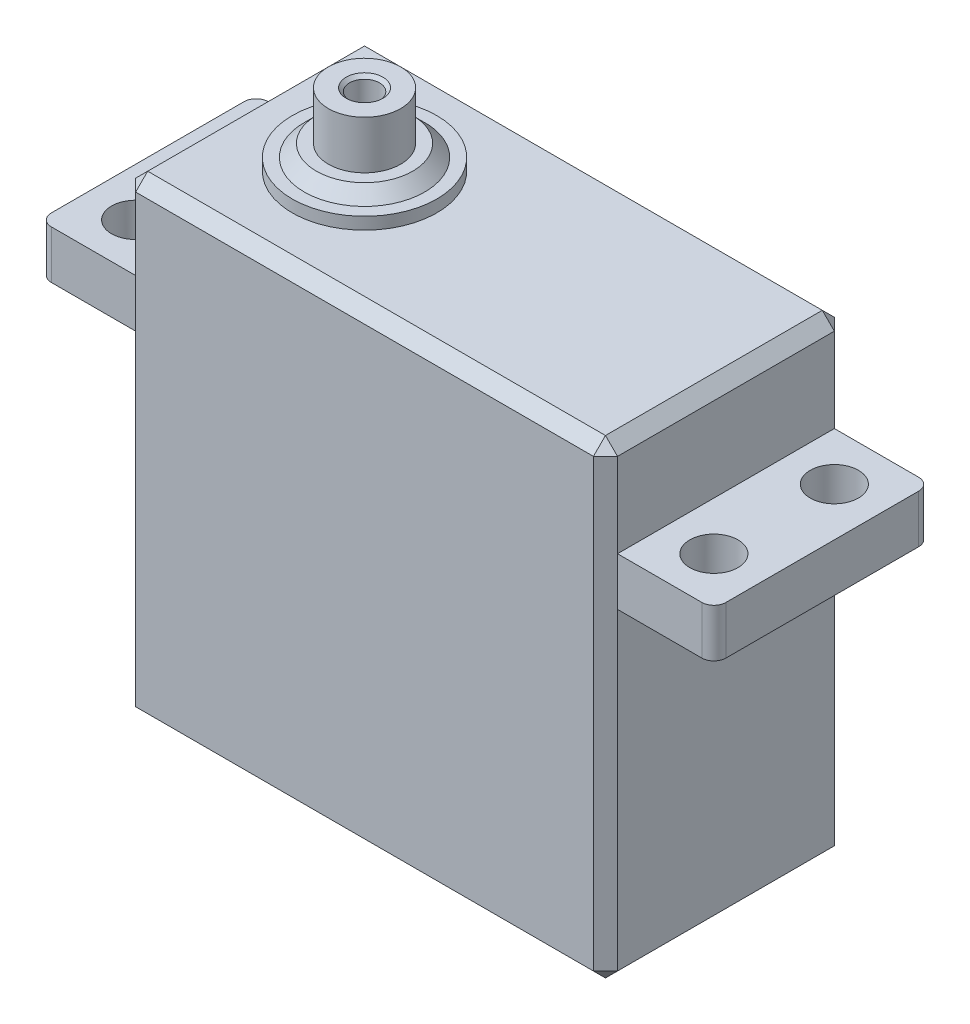
from build123d import *

# Parameters (mm, degrees)
SKETCH_1_W                   = 40
SKETCH_1_H                   = 20
EXTRUDE_1_DEPTH              = 39
CHAMFER_1_SIZE               = 1
SKETCH_12_W                  = 18
SKETCH_12_H                  = 4
EXTRUDE_7_DEPTH              = 8
SKETCH_13_R                  = 2
CUT_EXTRUDE_2_DEPTH          = 43.95346319
FILLET_3_R                   = 1
SKETCH_14_R                  = 6
EXTRUDE_8_DEPTH              = 1
SKETCH_15_R                  = 5
EXTRUDE_9_DEPTH              = 1
SKETCH_16_R                  = 3
EXTRUDE_10_DEPTH             = 4
HOLE_WIZARD_M3_2_D           = 2.5
HOLE_WIZARD_M3_2_DEPTH       = 7.5
HOLE_WIZARD_M3_2_CSINK_D     = 3.05
HOLE_WIZARD_M3_2_CSINK_ANGLE = 90
HOLE_WIZARD_M3_2_TIP         = 0.751075774
CHAMFER_3_SIZE               = 1


with BuildPart() as part:
    # 草图1 → 凸台-拉伸1 (new body)
    with BuildSketch(Plane(origin=(0, 0, 0), x_dir=(1, 0, 0), z_dir=(0, 1, 0))):
        Rectangle(SKETCH_1_W, SKETCH_1_H)
    extrude(amount=EXTRUDE_1_DEPTH)

    # 倒角1
    chamfer_1_edges = [part.edges().sort_by_distance(p)[0] for p in [
        (-20, 39, 0),
        (0, 39, 10),
        (20, 39, 0),
        (0, 0, 10),
        (-20, 0, 0),
        (0, 0, -10),
        (20, 0, 0),
        (20, 19.5, 10),
        (-20, 19.5, 10),
        (-20, 19.5, -10),
        (20, 19.5, -10),
        (0, 39, -10),
    ]]
    chamfer(chamfer_1_edges, length=CHAMFER_1_SIZE)

    # 草图12 → 凸台-拉伸7 (add)
    with BuildSketch(Plane.ZY.offset(20)):
        with Locations((0, 29)):
            Rectangle(SKETCH_12_W, SKETCH_12_H)
    extrude_7 = extrude(amount=EXTRUDE_7_DEPTH)

    # 镜向1: 凸台-拉伸7 across plane
    add(extrude_7.mirror(Plane(origin=(0, 0, 0), x_dir=(0, 0, 1), z_dir=(1, 0, 0))))

    # 草图13 → 切除-拉伸2 (cut, through all)
    with BuildSketch(Plane(origin=(0, 31, 0), x_dir=(1, 0, 0), z_dir=(0, 1, 0))):
        with Locations(Location((-24, 5, 0), (0, 0, 270))):
            Circle(SKETCH_13_R)
        with Locations(Location((-24, -5, 0), (0, 0, 270))):
            Circle(SKETCH_13_R)
        with Locations(Location((24, -5, 0), (0, 0, 270))):
            Circle(SKETCH_13_R)
        with Locations(Location((24, 5, 0), (0, 0, 90))):
            Circle(SKETCH_13_R)
    extrude(amount=-CUT_EXTRUDE_2_DEPTH, mode=Mode.SUBTRACT)

    # 圆角3
    fillet_3_edges = [part.edges().sort_by_distance(p)[0] for p in [
        (-28, 29, 9),
        (-28, 29, -9),
        (28, 29, 9),
        (28, 29, -9),
    ]]
    fillet(fillet_3_edges, radius=FILLET_3_R)

    # 草图14 → 凸台-拉伸8 (add)
    with BuildSketch(Plane(origin=(0, 39, 0), x_dir=(1, 0, 0), z_dir=(0, 1, 0))):
        with Locations(Location((-10, 0, 0), (0, 0, 90))):
            Circle(SKETCH_14_R)
    extrude(amount=EXTRUDE_8_DEPTH)

    # 草图15 → 凸台-拉伸9 (add)
    with BuildSketch(Plane(origin=(0, 40, 0), x_dir=(1, 0, 0), z_dir=(0, 1, 0))):
        with Locations(Location((-10, 0, 0), (0, 0, 270))):
            Circle(SKETCH_15_R)
    extrude(amount=EXTRUDE_9_DEPTH)

    # 草图16 → 凸台-拉伸10 (add)
    with BuildSketch(Plane(origin=(0, 41, 0), x_dir=(1, 0, 0), z_dir=(0, 1, 0))):
        with Locations(Location((-10, 0, 0), (0, 0, 270))):
            Circle(SKETCH_16_R)
    extrude(amount=EXTRUDE_10_DEPTH)

    # M3 螺纹孔2
    with Locations(Plane(origin=(0, 45, 0), x_dir=(1, 0, 0), z_dir=(0, 1, 0))):
        with Locations((-10, 0)):
            CounterSinkHole(HOLE_WIZARD_M3_2_D / 2, HOLE_WIZARD_M3_2_CSINK_D / 2, depth=HOLE_WIZARD_M3_2_DEPTH, counter_sink_angle=HOLE_WIZARD_M3_2_CSINK_ANGLE)
            with Locations((0, 0, -(HOLE_WIZARD_M3_2_DEPTH + HOLE_WIZARD_M3_2_TIP / 2))):  # 118° drill point
                Cone(0, HOLE_WIZARD_M3_2_D / 2, HOLE_WIZARD_M3_2_TIP, mode=Mode.SUBTRACT)

    # 倒角3
    chamfer_3_edges = [part.edges().sort_by_distance(p)[0] for p in [
        (-10, 41, -5),
    ]]
    chamfer(chamfer_3_edges, length=CHAMFER_3_SIZE - 0.0001)  # a hair under: the kernel refuses the full size


solid = part.part
